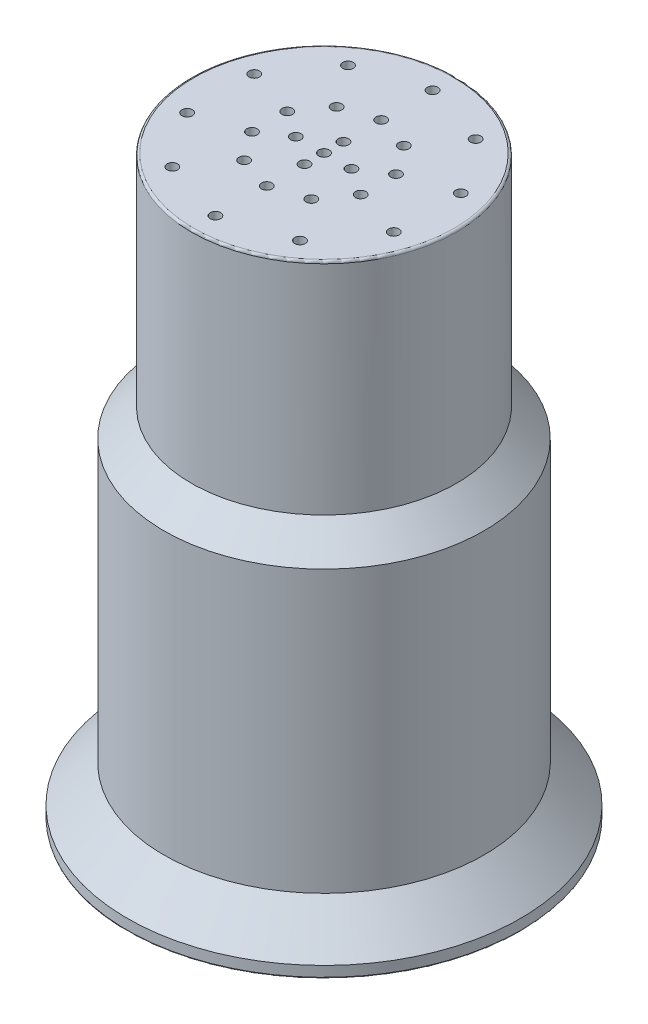
from build123d import *

# Parameters (mm, degrees)
SKETCH2_R          = 2.3
CUT_EXTRUDE1_DEPTH = 6
SKETCH4_R          = 2.3
CUT_EXTRUDE2_DEPTH = 6
FILLET15_R         = 0.5
FILLET16_R         = 1
CIRPATTERN1_COUNT  = 16
FILLET17_R         = 1


with BuildPart() as part:
    # Sketch1 → Revolve1 (revolve)
    with BuildSketch(Plane.XY):
        Polygon((86, 5), (70, 21), (70, 143.828427125), (58, 155.828427125), (58, 252), (0, 252), (0, 244), (4.006487596, 244), (56, 244), (56, 155), (68, 143), (68, 0), (86, 0), align=None)
    revolve(axis=Axis((0, 252, 0), (0, -1, 0)))

    # Sketch2 → Cut-Extrude1 (cut)
    with BuildSketch(Plane.XZ):
        with Locations((78.5, 0)):
            Circle(SKETCH2_R)
    cut_extrude1 = extrude(amount=-CUT_EXTRUDE1_DEPTH, mode=Mode.SUBTRACT)

    # Sketch4 → Cut-Extrude2 (cut)
    with BuildSketch(Plane(origin=(0, 252, 0), x_dir=(1, 0, 0), z_dir=(0, 1, 0))):
        with Locations((0, 47.5)):
            Circle(SKETCH4_R)
        with Locations((0, 25)):
            Circle(SKETCH4_R)
        with Locations((27.919799484, 38.428307233)):
            Circle(SKETCH4_R)
        with Locations((14.694631307, 20.225424859)):
            Circle(SKETCH4_R)
        with Locations((45.175184524, 14.678307233)):
            Circle(SKETCH4_R)
        with Locations((23.776412907, 7.725424859)):
            Circle(SKETCH4_R)
        with Locations((45.175184524, -14.678307233)):
            Circle(SKETCH4_R)
        with Locations((23.776412907, -7.725424859)):
            Circle(SKETCH4_R)
        with Locations((27.919799484, -38.428307233)):
            Circle(SKETCH4_R)
        with Locations((14.694631307, -20.225424859)):
            Circle(SKETCH4_R)
        with Locations((0, -47.5)):
            Circle(SKETCH4_R)
        with Locations((0, -25)):
            Circle(SKETCH4_R)
        with Locations((-27.919799484, -38.428307233)):
            Circle(SKETCH4_R)
        with Locations((-14.694631307, -20.225424859)):
            Circle(SKETCH4_R)
        with Locations((-45.175184524, -14.678307233)):
            Circle(SKETCH4_R)
        with Locations((-23.776412907, -7.725424859)):
            Circle(SKETCH4_R)
        with Locations((-45.175184524, 14.678307233)):
            Circle(SKETCH4_R)
        with Locations((-23.776412907, 7.725424859)):
            Circle(SKETCH4_R)
        with Locations((-27.919799484, 38.428307233)):
            Circle(SKETCH4_R)
        with Locations((-14.694631307, 20.225424859)):
            Circle(SKETCH4_R)
        Circle(SKETCH4_R)
        with Locations((11.997484215, 0)):
            Circle(SKETCH4_R)
        with Locations((-12.341543393, 0)):
            Circle(SKETCH4_R)
        with Locations((0, 8.5)):
            Circle(SKETCH4_R)
        with Locations((0, -8.5)):
            Circle(SKETCH4_R)
    extrude(amount=-CUT_EXTRUDE2_DEPTH, mode=Mode.SUBTRACT)

    # Fillet15
    fillet15_edges = [part.edges().sort_by_distance(p)[0] for p in [
        (-86, 0, 0),
    ]]
    fillet(fillet15_edges, radius=FILLET15_R)

    # Fillet16
    fillet16_edges = [part.edges().sort_by_distance(p)[0] for p in [
        (-58, 252, 0),
    ]]
    fillet(fillet16_edges, radius=FILLET16_R)

    # CirPattern1: Cut-Extrude1 ×16 about axis
    cirpattern1_axis = Axis((0, 0, 0), (0, 1, 0))
    for i in range(1, CIRPATTERN1_COUNT):
        add(cut_extrude1.rotate(cirpattern1_axis, i * 360 / CIRPATTERN1_COUNT), mode=Mode.SUBTRACT)

    # Fillet17
    fillet17_edges = [part.edges().sort_by_distance(p)[0] for p in [
        (-56, 244, 0),
    ]]
    fillet(fillet17_edges, radius=FILLET17_R)


solid = part.part
